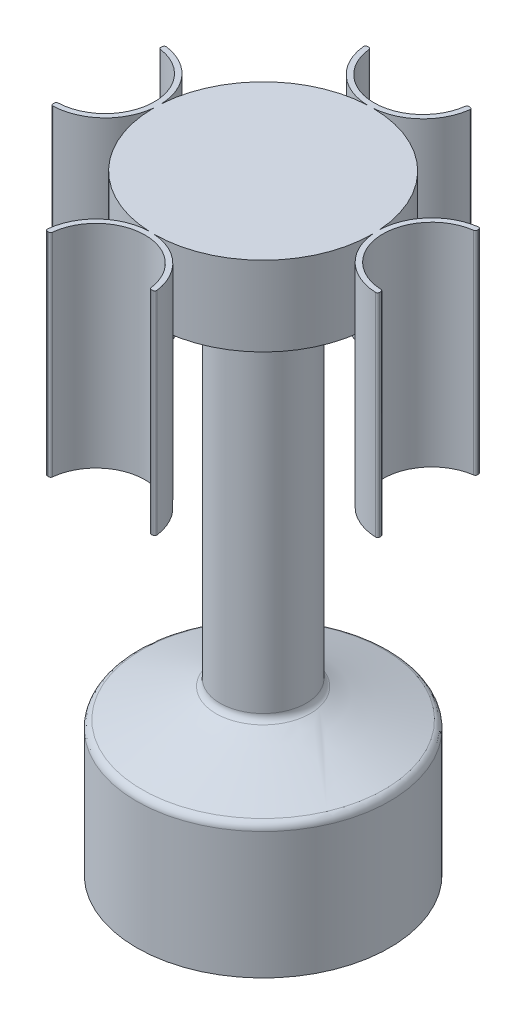
from build123d import *

# Parameters (mm, degrees)
SKETCH1_R           = 95.492297116
BOSS_EXTRUDE1_DEPTH = 100
SKETCH3_3_R         = 32.5
TUBE_DEPTH          = 275
SKETCH5_R           = 82.5
TOP_HUB_DEPTH       = 60
BLADES_DEPTH        = 160
FILLET3_R           = 1.5
FILLET5_R           = 6
FILLET6_R           = 6


with BuildPart() as part:
    # Sketch1 → Boss-Extrude1 (new body)
    with BuildSketch(Plane(origin=(0, 0, 0), x_dir=(1, 0, 0), z_dir=(0, 1, 0))):
        with Locations(Location((0, 0, 0), (0, 0, 270))):
            Circle(SKETCH1_R)
    extrude(amount=BOSS_EXTRUDE1_DEPTH)

    # Loft2: read off the stored shape, not the designer's step
    # Loft2: loft between two sections, ruled curve by curve
    loft2_from = [
        Edge.make_bspline([(30.430707277, 125, -11.411487835), (53.253682947, 125, 49.44992672), (-7.607731608, 125, 72.272902389), (-30.430707277, 125, 11.411487835), (-53.253682947, 125, -49.44992672), (7.607731608, 125, -72.272902389), (30.430707277, 125, -11.411487835)], [0, 0, 0, 0, 0.5, 0.5, 0.5, 1, 1, 1, 1], 3, [1, 0.333333333, 0.333333333, 1, 0.333333333, 0.333333333, 1]),
    ]
    loft2_to = [
        Edge.make_bspline([(87.277179809, 100, 38.748841183), (9.779497444, 100, 213.303200802), (-164.774862175, 100, 135.805518436), (-87.277179809, 100, -38.748841183), (-9.779497444, 100, -213.303200802), (164.774862175, 100, -135.805518436), (87.277179809, 100, 38.748841183)], [0, 0, 0, 0, 0.5, 0.5, 0.5, 1, 1, 1, 1], 3, [1, 0.333333333, 0.333333333, 1, 0.333333333, 0.333333333, 1]),
    ]
    loft2 = Solid(Shell([*[Face.make_surface_from_curves(loft2_from[k], loft2_to[k]) for k in range(1)], Face(Wire(loft2_from)), Face(Wire(loft2_to))]))
    add(loft2)

    # Sketch3<3> → tube (add)
    with BuildSketch(Plane(origin=(0, 125, 0), x_dir=(1, 0, 0), z_dir=(0, 1, 0))):
        with Locations(Location((0, 0, 0), (0, 0, 20.556))):
            Circle(SKETCH3_3_R)
    extrude(amount=TUBE_DEPTH)

    # Sketch5 → top_hub (add)
    with BuildSketch(Plane(origin=(0, 400, 0), x_dir=(1, 0, 0), z_dir=(0, 1, 0))):
        with Locations(Location((0, 0, 0), (0, 0, 270))):
            Circle(SKETCH5_R)
    extrude(amount=TOP_HUB_DEPTH)

    # Sketch8 → Blades (add)
    with BuildSketch(Plane(origin=(0, 460, 0), x_dir=(1, 0, 0), z_dir=(0, 1, 0))):
        with BuildLine():
            ThreePointArc((123.296710019, -36.922200146), (95.784801634, -26.321129354), (82.5, 0))
            ThreePointArc((82.5, 0), (91.565639785, 30.041990229), (119.218910164, 44.874509873))
            Line((119.218910164, 44.874509873), (119.616744296, 40.894343042))
            ThreePointArc((119.616744296, 40.894343042), (94.661353954, 27.508898485), (86.480166831, 0.397834132))
            ThreePointArc((86.480166831, 0.397834132), (98.468890257, -23.355380163), (123.296710019, -32.922200146))
            Line((123.296710019, -32.922200146), (123.296710019, -36.922200146))
        make_face()
        with BuildLine():
            ThreePointArc((-119.218910164, 44.874509873), (-91.565639785, 30.041990229), (-82.5, 0))
            ThreePointArc((-82.5, 0), (-95.784801634, -26.321129354), (-123.296710019, -36.922200146))
            Line((-123.296710019, -36.922200146), (-123.296710019, -32.922200146))
            ThreePointArc((-123.296710019, -32.922200146), (-98.468890257, -23.355380163), (-86.480166831, 0.397834132))
            ThreePointArc((-86.480166831, 0.397834132), (-94.661353954, 27.508898485), (-119.616744296, 40.894343042))
            Line((-119.616744296, 40.894343042), (-119.218910164, 44.874509873))
        make_face()
        with BuildLine():
            ThreePointArc((38.088025782, 119.593401567), (25.871262622, 94.036384856), (0, 82.5))
            ThreePointArc((0, 82.5), (-29.727635854, 92.548615238), (-43.642804778, 120.674672115))
            Line((-43.642804778, 120.674672115), (-39.651708344, 120.941410294))
            ThreePointArc((-39.651708344, 120.941410294), (-27.094116876, 95.559358966), (-0.266738179, 86.491096434))
            ThreePointArc((-0.266738179, 86.491096434), (23.080498822, 96.901980328), (34.105382649, 119.965629555))
            Line((34.105382649, 119.965629555), (38.088025782, 119.593401567))
        make_face()
        with BuildLine():
            ThreePointArc((-43.642804778, -120.674672115), (-29.727635854, -92.548615238), (0, -82.5))
            ThreePointArc((0, -82.5), (25.871262622, -94.036384856), (38.088025782, -119.593401567))
            Line((38.088025782, -119.593401567), (34.105382649, -119.965629555))
            ThreePointArc((34.105382649, -119.965629555), (23.080498822, -96.901980328), (-0.266738179, -86.491096434))
            ThreePointArc((-0.266738179, -86.491096434), (-27.094116876, -95.559358966), (-39.651708344, -120.941410294))
            Line((-39.651708344, -120.941410294), (-43.642804778, -120.674672115))
        make_face()
    extrude(amount=-BLADES_DEPTH)

    # Fillet3
    fillet3_edges = [part.edges().sort_by_distance(p)[0] for p in [
        (123.296710019, 380, 36.922200146),
        (119.218910164, 380, -44.874509873),
        (119.616744296, 380, -40.894343042),
        (123.296710019, 380, 32.922200146),
        (-119.218910164, 380, -44.874509873),
        (-123.296710019, 380, 36.922200146),
        (-123.296710019, 380, 32.922200146),
        (-119.616744296, 380, -40.894343042),
        (38.088025782, 380, -119.593401567),
        (-43.642804778, 380, -120.674672115),
        (-39.651708344, 380, -120.941410294),
        (34.105382649, 380, -119.965629555),
        (-43.642804778, 380, 120.674672115),
        (38.088025782, 380, 119.593401567),
        (34.105382649, 380, 119.965629555),
        (-39.651708344, 380, 120.941410294),
    ]]
    fillet(fillet3_edges, radius=FILLET3_R)

    # Fillet5
    fillet5_edges = [part.edges().sort_by_distance(p)[0] for p in [
        (52.050758656, 100, 80.059336319),
        (-30.430707277, 125, 11.411487835),
    ]]
    fillet(fillet5_edges, radius=FILLET5_R)

    # Fillet6
    fillet6_edges = [part.edges().sort_by_distance(p)[0] for p in [
        (-30.430707277, 400, 11.411487835),
    ]]
    fillet(fillet6_edges, radius=FILLET6_R)


solid = part.part
